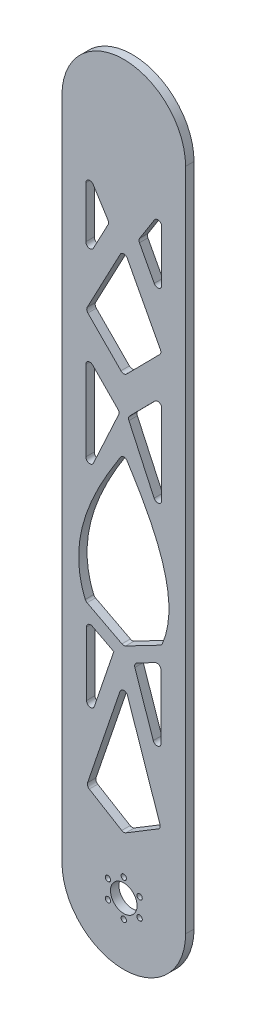
from build123d import *

# Parameters (mm, degrees)
SKETCH2_R           = 10
SKETCH2_R_2         = 2
BOSS_EXTRUDE1_DEPTH = 6.35
CUT_EXTRUDE1_DEPTH  = 10
FILLET3_R           = 3


with BuildPart() as part:
    # Sketch2 → Boss-Extrude1 (new body)
    with BuildSketch(Plane.XY):
        with BuildLine():
            Line((-46.5, 0), (-46.5, 500))
            ThreePointArc((-46.5, 500), (0, 546.5), (46.5, 500))
            Line((46.5, 500), (46.5, 0))
            ThreePointArc((46.5, 0), (0, -46.5), (-46.5, 0))
        make_face()
        Circle(SKETCH2_R, mode=Mode.SUBTRACT)
        with Locations((0, 13.75)):
            Circle(SKETCH2_R_2, mode=Mode.SUBTRACT)
        with Locations((11.907849302, 6.875)):
            Circle(SKETCH2_R_2, mode=Mode.SUBTRACT)
        with Locations((11.907849302, -6.875)):
            Circle(SKETCH2_R_2, mode=Mode.SUBTRACT)
        with Locations((0, -13.75)):
            Circle(SKETCH2_R_2, mode=Mode.SUBTRACT)
        with Locations((-11.907849302, -6.875)):
            Circle(SKETCH2_R_2, mode=Mode.SUBTRACT)
        with Locations((-11.907849302, 6.875)):
            Circle(SKETCH2_R_2, mode=Mode.SUBTRACT)
    extrude(amount=BOSS_EXTRUDE1_DEPTH)

    # Sketch4 → Cut-Extrude1 (cut)
    with BuildSketch(Plane.XY.offset(6.35)):
        Polygon((28.005258112, 59.37595418), (0, 42.411661153), (-28.005258112, 59.37595418), (0, 141.693437584), align=None)
        Polygon((-7.5, 156.905935087), (-28.005258112, 96.633637735), (-28.005258112, 167.582877854), align=None)
        Polygon((28.005258112, 167.582877854), (7.5, 156.905935087), (28.005258112, 96.633637735), align=None)
        with BuildLine():
            Line((0, 164.275138905), (28.550546746, 179.141206521))
            add(Edge.make_bspline(
                [(28.550546746, 179.141206521), (45.32025339, 216.985654627), (19.430092874, 259.790255689), (0, 290.025756679)],
                knots=[0, 0, 0, 0, 1, 1, 1, 1], degree=3))
            add(Edge.make_bspline(
                [(-28.550546746, 179.141206521), (-45.32025339, 216.985654627), (-19.430092874, 259.790255689), (0, 290.025756679)],
                knots=[0, 0, 0, 0, 1, 1, 1, 1], degree=3))
            Line((-28.550546746, 179.141206521), (0, 164.275138905))
        make_face()
        Polygon((28.550546746, 259.58677623), (3, 314.938284003), (28.550546746, 340.793051053), align=None)
        Polygon((-3, 314.938284003), (-28.550546746, 340.793051053), (-28.550546746, 259.58677623), align=None)
        Polygon((0, 423.142843498), (-28.550546746, 369.246205395), (0, 340.355718526), (28.550546746, 369.246205395), align=None)
        Polygon((-28.550546746, 462.095190817), (-28.550546746, 401.290241252), (-11, 434.421497018), align=None)
        Polygon((28.550546746, 401.290241252), (11, 434.421497018), (28.550546746, 462.095190817), align=None)
    extrude(amount=-CUT_EXTRUDE1_DEPTH, mode=Mode.SUBTRACT)

    # Fillet3
    fillet3_edges = [part.edges().sort_by_distance(p)[0] for p in [
        (-11, 434.421497018, 3.175),
        (-28.550546746, 401.290241252, 3.175),
        (28.550546746, 401.290241252, 3.175),
        (11, 434.421497018, 3.175),
        (28.550546746, 462.095190817, 3.175),
        (-28.550546746, 462.095190817, 3.175),
        (0, 423.142843498, 3.175),
        (-28.550546746, 369.246205395, 3.175),
        (28.550546746, 369.246205395, 3.175),
        (0, 340.355718526, 3.175),
        (28.550546746, 340.793051053, 3.175),
        (-28.550546746, 340.793051053, 3.175),
        (-3, 314.938284003, 3.175),
        (3, 314.938284003, 3.175),
        (28.550546746, 259.58677623, 3.175),
        (-28.550546746, 259.58677623, 3.175),
        (28.550546746, 179.141206521, 3.175),
        (0, 290.025756679, 3.175),
        (-28.550546746, 179.141206521, 3.175),
        (0, 164.275138905, 3.175),
        (-28.005258112, 96.633637735, 3.175),
        (28.005258112, 96.633637735, 3.175),
        (7.5, 156.905935087, 3.175),
        (-28.005258112, 167.582877854, 3.175),
        (28.005258112, 167.582877854, 3.175),
        (0, 141.693437584, 3.175),
        (28.005258112, 59.37595418, 3.175),
        (-28.005258112, 59.37595418, 3.175),
        (0, 42.411661153, 3.175),
    ]]
    fillet(fillet3_edges, radius=FILLET3_R)


solid = part.part
